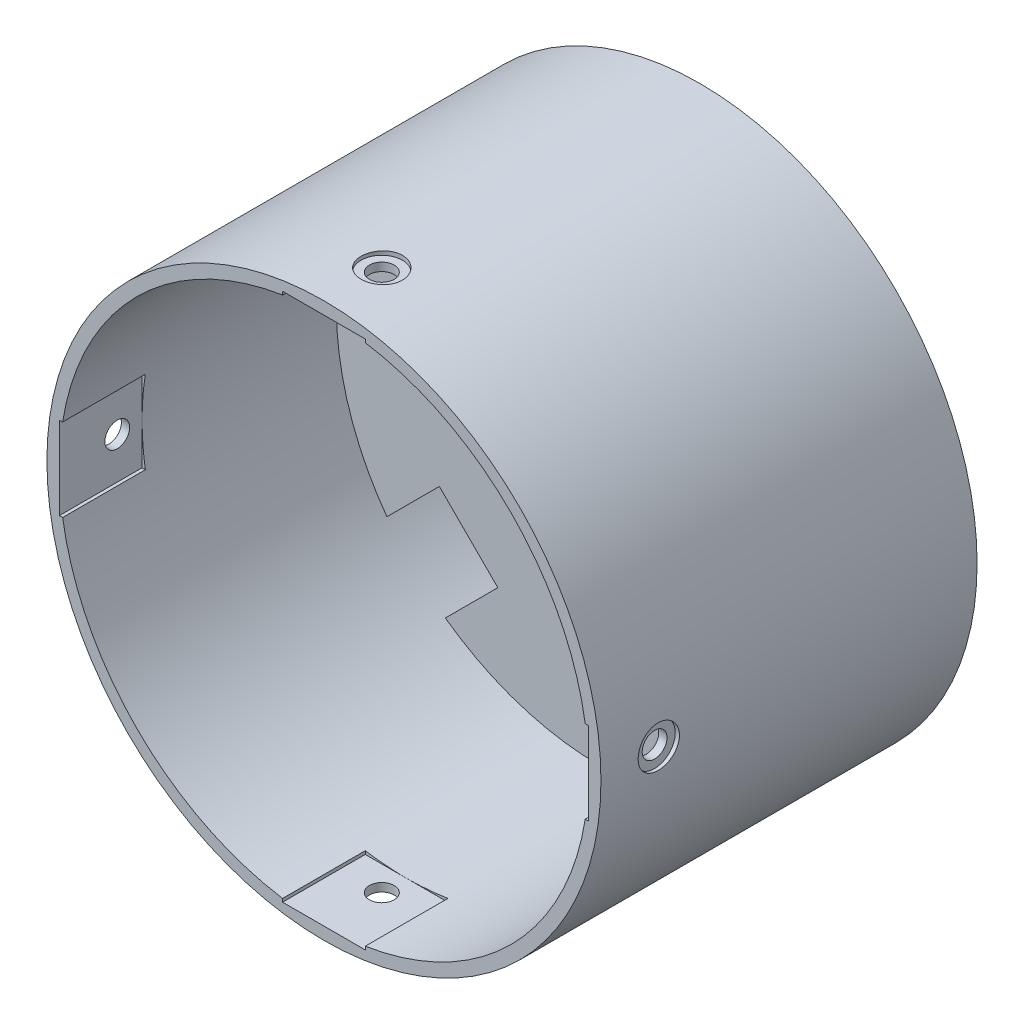
from build123d import *
from build123d.topology import SkipClean

# Parameters (mm, degrees)
SKETCH1_R               = 33.51
BOSS_EXTRUDE1_DEPTH     = 2
SKETCH2_R               = 33.51
SKETCH2_R_2             = 32
BOSS_EXTRUDE2_DEPTH     = 23.5
SKETCH3_R               = 1.5
CUT_EXTRUDE1_DEPTH      = 54.815334246
SKETCH4_R               = 10
CUT_EXTRUDE2_DEPTH      = 53.896977229
CUT_EXTRUDE3_DEPTH      = 53.896977229
CUT_EXTRUDE3_DEPTH_BACK = 10
BOSS_EXTRUDE3_START     = 10
SKETCH6_R               = 33.51
SKETCH6_R_2             = 32
BOSS_EXTRUDE3_DEPTH     = 10
FILLET1_R               = 1
SKETCH7_R               = 33.51
SKETCH7_R_2             = 32
BOSS_EXTRUDE4_DEPTH     = 10
CUT_EXTRUDE4_DEPTH      = 10
SKETCH9_R               = 1.5
CUT_EXTRUDE5_DEPTH      = 10
CIRPATTERN1_COUNT       = 4
SKETCH11_R              = 2.5
CUT_EXTRUDE6_DEPTH      = 1
CIRPATTERN2_COUNT       = 4


with BuildPart() as part:
    # Sketch1 → Boss-Extrude1 (new body)
    with BuildSketch(Plane.XY):
        Circle(SKETCH1_R)
    extrude(amount=BOSS_EXTRUDE1_DEPTH)

    # Sketch2 → Boss-Extrude2 (add)
    with BuildSketch(Plane.XY.offset(2)):
        Circle(SKETCH2_R)
        Circle(SKETCH2_R_2, mode=Mode.SUBTRACT)
    extrude(amount=BOSS_EXTRUDE2_DEPTH)

    # Sketch3 → Cut-Extrude1 (cut, through all)
    with BuildSketch(Plane(origin=(0, 0, 0), x_dir=(-1, 0, 0), z_dir=(0, 0, -1))):
        with Locations((21.85, 0)):
            Circle(SKETCH3_R)
        with Locations((13.01, 0)):
            Circle(SKETCH3_R)
        with Locations((0, -21.85)):
            Circle(SKETCH3_R)
        with Locations((0, -13.01)):
            Circle(SKETCH3_R)
        with Locations((-21.85, 0)):
            Circle(SKETCH3_R)
        with Locations((-13.01, 0)):
            Circle(SKETCH3_R)
        with Locations((0, 21.85)):
            Circle(SKETCH3_R)
        with Locations((0, 13.01)):
            Circle(SKETCH3_R)
    extrude(amount=-CUT_EXTRUDE1_DEPTH, mode=Mode.SUBTRACT)

    # Sketch4 → Cut-Extrude2 (cut, through all)
    with BuildSketch(Plane.XY.offset(2)):
        Circle(SKETCH4_R)
    extrude(amount=-CUT_EXTRUDE2_DEPTH, mode=Mode.SUBTRACT)

    # Sketch5 → Cut-Extrude3 (cut, two sides: drawn at the far end of the back side and taken through both)
    with BuildSketch(Plane.XY.offset(2).offset(-CUT_EXTRUDE3_DEPTH_BACK)):
        with BuildLine():
            Line((-12.464466094, 19.535533906), (-18.813962733, 25.885030545))
            ThreePointArc((-18.813962733, 25.885030545), (-22.627416998, 22.627416998), (-25.885030545, 18.813962733))
            Line((-25.885030545, 18.813962733), (-19.535533906, 12.464466094))
            Line((-19.535533906, 12.464466094), (-12.464466094, 19.535533906))
        make_face()
        with BuildLine():
            Line((19.535533906, 12.464466094), (25.885030545, 18.813962733))
            ThreePointArc((25.885030545, 18.813962733), (22.627416998, 22.627416998), (18.813962733, 25.885030545))
            Line((18.813962733, 25.885030545), (12.464466094, 19.535533906))
            Line((12.464466094, 19.535533906), (19.535533906, 12.464466094))
        make_face()
        with BuildLine():
            Line((-19.535533906, -12.464466094), (-25.885030545, -18.813962733))
            ThreePointArc((-25.885030545, -18.813962733), (-22.627416998, -22.627416998), (-18.813962733, -25.885030545))
            Line((-18.813962733, -25.885030545), (-12.464466094, -19.535533906))
            Line((-12.464466094, -19.535533906), (-19.535533906, -12.464466094))
        make_face()
        with BuildLine():
            ThreePointArc((18.813962733, -25.885030545), (22.627416998, -22.627416998), (25.885030545, -18.813962733))
            Line((25.885030545, -18.813962733), (19.535533906, -12.464466094))
            Line((19.535533906, -12.464466094), (12.464466094, -19.535533906))
            Line((12.464466094, -19.535533906), (18.813962733, -25.885030545))
        make_face()
    extrude(amount=CUT_EXTRUDE3_DEPTH + CUT_EXTRUDE3_DEPTH_BACK, mode=Mode.SUBTRACT)

    # Sketch6 → Boss-Extrude3 (add)
    with BuildSketch(Plane(origin=(0, 0, 0), x_dir=(-1, 0, 0), z_dir=(0, 0, -1)).offset(BOSS_EXTRUDE3_START)):
        Circle(SKETCH6_R)
        Circle(SKETCH6_R_2, mode=Mode.SUBTRACT)
    extrude(amount=-BOSS_EXTRUDE3_DEPTH)

    # Fillet1
    # the kernel refuses this fillet: 1 mm, written as the material it adds along each edge
    with BuildSketch(Plane(origin=(0, 0, 0), x_dir=(-1, 0, 0), z_dir=(0, -1, 0))) as fillet1_piece_1_section:
        with BuildLine():
            CenterArc((32 - FILLET1_R, FILLET1_R), FILLET1_R, 270, 90)
            Line((32 - FILLET1_R, 0), (32, 0))
            Line((32, 0), (32, FILLET1_R))
        make_face()
    fillet1_piece_1 = revolve(axis=Axis((0, 0, 0), (0, 0, -1)), revolution_arc=40.487221235, mode=Mode.PRIVATE)
    fillet1_piece_1 = split(fillet1_piece_1, bisect_by=Plane(origin=(-23.520787378, 16.449719566, -0.28073515), z_dir=(-0.707106781186554, -0.707106781186541, 0)), keep=Keep.TOP, mode=Mode.PRIVATE)
    add(fillet1_piece_1)
    with BuildSketch(Plane(origin=(0, 0, 0), x_dir=(0.6492899007478581, -0.7605410079587009, 0), z_dir=(0.7605410079587009, 0.6492899007478581, 0))) as fillet1_piece_2_section:
        with BuildLine():
            CenterArc((32 - FILLET1_R, FILLET1_R), FILLET1_R, 270, 90)
            Line((32 - FILLET1_R, 0), (32, 0))
            Line((32, 0), (32, FILLET1_R))
        make_face()
    fillet1_piece_2 = revolve(axis=Axis((0, 0, 0), (0, 0, -1)), revolution_arc=80.976169612, mode=Mode.PRIVATE)
    fillet1_piece_2 = split(fillet1_piece_2, bisect_by=Plane(origin=(12.325678578, -19.39674639, -0.277575032), z_dir=(-0.7071067811865488, -0.7071067811865462, 0)), keep=Keep.TOP, mode=Mode.PRIVATE)
    fillet1_piece_2 = split(fillet1_piece_2, bisect_by=Plane(origin=(-12.325678578, -19.39674639, -0.277575032), z_dir=(0.7071067811865432, -0.7071067811865519, 0)), keep=Keep.TOP, mode=Mode.PRIVATE)
    add(fillet1_piece_2)
    with BuildSketch(Plane(origin=(0, 0, 0), x_dir=(0.7605410079586984, 0.6492899007478611, 0), z_dir=(-0.6492899007478611, 0.7605410079586984, 0))) as fillet1_piece_3_section:
        with BuildLine():
            CenterArc((32 - FILLET1_R, FILLET1_R), FILLET1_R, 270, 90)
            Line((32 - FILLET1_R, 0), (32, 0))
            Line((32, 0), (32, FILLET1_R))
        make_face()
    fillet1_piece_3 = revolve(axis=Axis((0, 0, 0), (0, 0, -1)), revolution_arc=80.976169612, mode=Mode.PRIVATE)
    fillet1_piece_3 = split(fillet1_piece_3, bisect_by=Plane(origin=(19.39674639, -12.325678578, -0.277575032), z_dir=(0.7071067811865495, 0.7071067811865457, 0)), keep=Keep.TOP, mode=Mode.PRIVATE)
    fillet1_piece_3 = split(fillet1_piece_3, bisect_by=Plane(origin=(19.39674639, 12.325678578, -0.277575032), z_dir=(0.7071067811865487, -0.7071067811865466, 0)), keep=Keep.TOP, mode=Mode.PRIVATE)
    add(fillet1_piece_3)
    with BuildSketch(Plane(origin=(0, 0, 0), x_dir=(-0.6492899007478526, 0.7605410079587055, 0), z_dir=(-0.7605410079587055, -0.6492899007478526, 0))) as fillet1_piece_4_section:
        with BuildLine():
            CenterArc((32 - FILLET1_R, FILLET1_R), FILLET1_R, 270, 90)
            Line((32 - FILLET1_R, 0), (32, 0))
            Line((32, 0), (32, FILLET1_R))
        make_face()
    fillet1_piece_4 = revolve(axis=Axis((0, 0, 0), (0, 0, -1)), revolution_arc=80.976169612, mode=Mode.PRIVATE)
    fillet1_piece_4 = split(fillet1_piece_4, bisect_by=Plane(origin=(-12.325678578, 19.39674639, -0.277575032), z_dir=(0.7071067811865538, 0.7071067811865415, 0)), keep=Keep.TOP, mode=Mode.PRIVATE)
    fillet1_piece_4 = split(fillet1_piece_4, bisect_by=Plane(origin=(12.325678578, 19.39674639, -0.277575032), z_dir=(-0.707106781186548, 0.707106781186547, 0)), keep=Keep.TOP, mode=Mode.PRIVATE)
    add(fillet1_piece_4)
    with BuildSketch(Plane(origin=(0, 0, 0), x_dir=(-0.7605507940779602, -0.6492784376732254, 0), z_dir=(0.6492784376732254, -0.7605507940779602, 0))) as fillet1_piece_5_section:
        with BuildLine():
            CenterArc((32 - FILLET1_R, FILLET1_R), FILLET1_R, 270, 90)
            Line((32 - FILLET1_R, 0), (32, 0))
            Line((32, 0), (32, FILLET1_R))
        make_face()
    fillet1_piece_5 = revolve(axis=Axis((0, 0, 0), (0, 0, -1)), revolution_arc=40.487221235, mode=Mode.PRIVATE)
    fillet1_piece_5 = split(fillet1_piece_5, bisect_by=Plane(origin=(-23.520787379, -16.449719567, -0.280735148), z_dir=(-0.7071067811865441, 0.707106781186551, 0)), keep=Keep.TOP, mode=Mode.PRIVATE)
    add(fillet1_piece_5)

    # Sketch7 → Boss-Extrude4 (add)
    with SkipClean():  # the faces are left unmerged after this step: merging them gives an invalid solid
        with BuildSketch(Plane.XY.offset(25.5)):
            with Locations(Location((0, 0, 0), (0, 0, 180))):
                Circle(SKETCH7_R)
            with Locations(Location((0, 0, 0), (0, 0, 180))):
                Circle(SKETCH7_R_2, mode=Mode.SUBTRACT)
        extrude(amount=BOSS_EXTRUDE4_DEPTH)
    add(part.part.scale(1), mode=Mode.REPLACE)  # the faces are merged on a copy

    # Sketch8 → Cut-Extrude4 (cut)
    with BuildSketch(Plane.XY.offset(35.5)):
        Polygon((32, 0), (32, 5), (31.606961259, 5), (31.606961259, -5), (32, -5), align=None)
        Polygon((-5, -32), (0, -32), (5, -32), (5, -31.606961259), (-5, -31.606961259), align=None)
        Polygon((-32, 5), (-32, 0), (-32, -5), (-31.606961259, -5), (-31.606961259, 5), align=None)
        Polygon((5, 32), (0, 32), (-5, 32), (-5, 31.606961259), (5, 31.606961259), align=None)
    extrude(amount=-CUT_EXTRUDE4_DEPTH, mode=Mode.SUBTRACT)

    # Sketch9 → Cut-Extrude5 (cut)
    with BuildSketch(Plane.XZ.offset(-32)):
        with Locations((0, 28.5)):
            Circle(SKETCH9_R)
    cut_extrude5 = extrude(amount=-CUT_EXTRUDE5_DEPTH, mode=Mode.SUBTRACT)

    # CirPattern1: Cut-Extrude5 ×4 about axis
    cirpattern1_axis = Axis((0, 0, 25.5), (0, 0, -1))
    for i in range(1, CIRPATTERN1_COUNT):
        add(cut_extrude5.rotate(cirpattern1_axis, i * 360 / CIRPATTERN1_COUNT), mode=Mode.SUBTRACT)

    # Sketch11 → Cut-Extrude6 (cut)
    with BuildSketch(Plane(origin=(0, 34, 0), x_dir=(-1, 0, 0), z_dir=(0, -1, 0))):
        with Locations((0, -28.5)):
            Circle(SKETCH11_R)
    cut_extrude6 = extrude(amount=CUT_EXTRUDE6_DEPTH, mode=Mode.SUBTRACT)

    # CirPattern2: Cut-Extrude6 ×4 about axis
    cirpattern2_axis = Axis((0, 0, 0), (0, 0, 1))
    for i in range(1, CIRPATTERN2_COUNT):
        add(cut_extrude6.rotate(cirpattern2_axis, i * 360 / CIRPATTERN2_COUNT), mode=Mode.SUBTRACT)


solid = part.part
